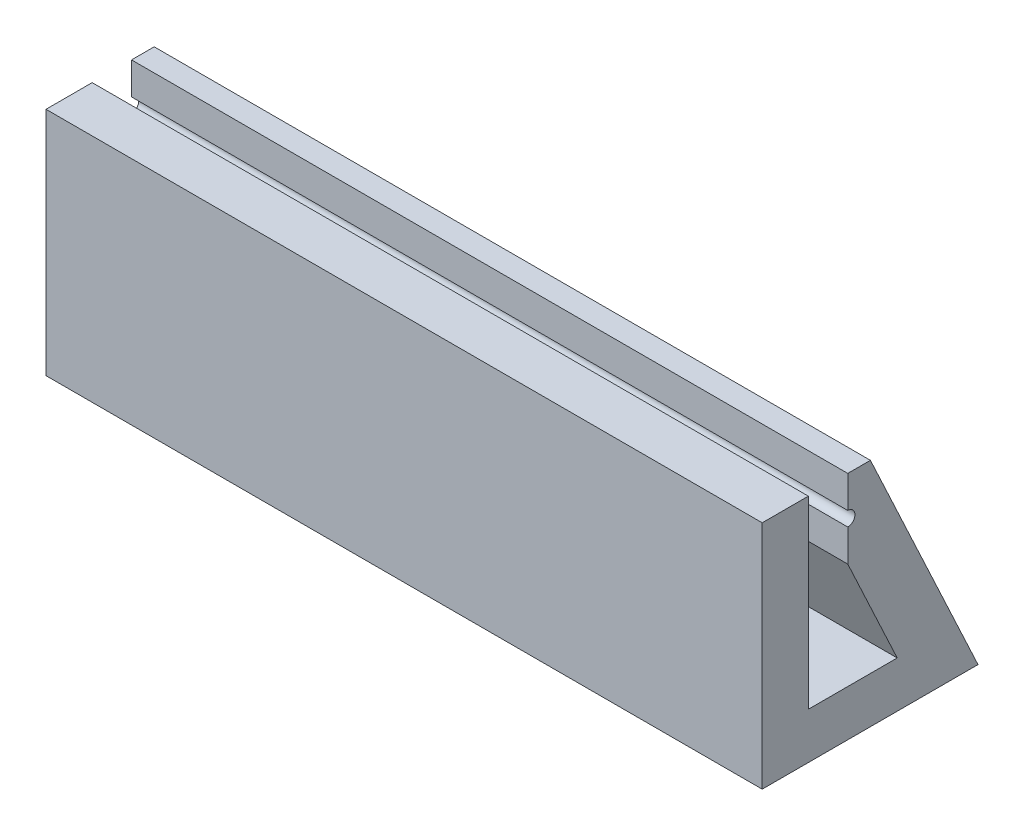
from build123d import *

# Parameters (mm, degrees)
BOSS_EXTRUDE1_DEPTH = 10


with BuildPart() as part:
    # Sketch1 → Boss-Extrude1 (new, symmetric)
    with BuildSketch(Plane(origin=(0, 0, 0), x_dir=(0, 0, -1), z_dir=(1, 0, 0))):
        with BuildLine():
            Line((0, 0), (6.025642589, 0))
            Line((6.025642589, 0), (3.021314774, 6.44280179))
            Line((3.021314774, 6.44280179), (2.388837523, 6.44280179))
            Line((2.388837523, 6.44280179), (2.388837523, 5.546326524))
            ThreePointArc((2.388837523, 5.546326524), (2.588837523, 5.346326524), (2.388837523, 5.146326524))
            Line((2.388837523, 5.146326524), (2.388837523, 4.249851258))
            Line((2.388837523, 4.249851258), (3.769580903, 1.288837523))
            Line((3.769580903, 1.288837523), (1.288837523, 1.288837523))
            Line((1.288837523, 1.288837523), (1.288837523, 6.44280179))
            Line((1.288837523, 6.44280179), (0, 6.44280179))
            Line((0, 6.44280179), (0, 0))
        make_face()
    extrude(amount=BOSS_EXTRUDE1_DEPTH, both=True)


solid = part.part
